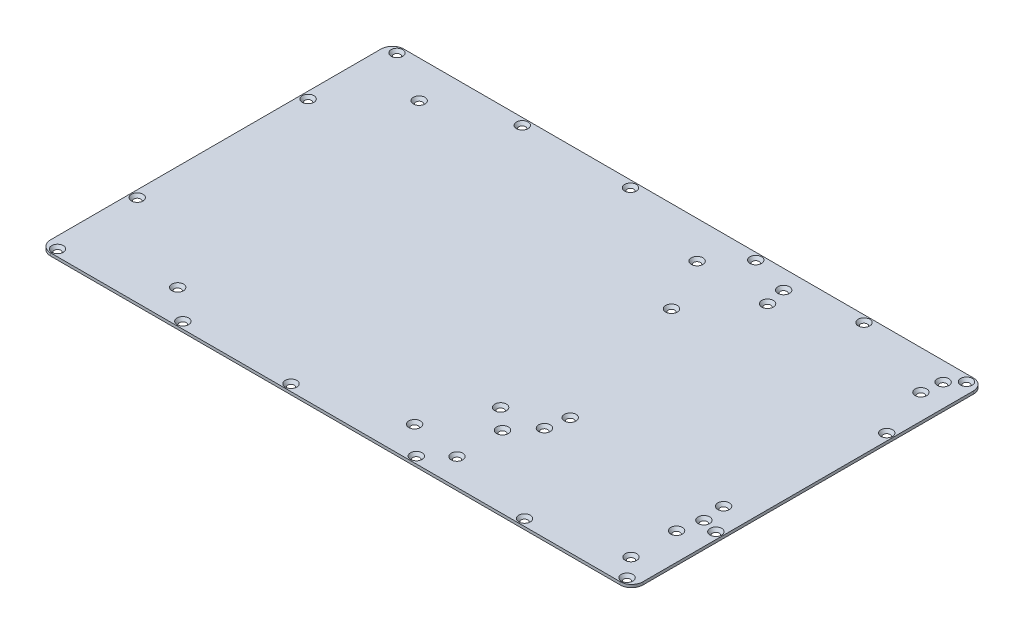
from build123d import *

# Parameters (mm, degrees)
SKETCH1_W                                     = 330.2
SKETCH1_H                                     = 196.85
BOSS_EXTRUDE1_DEPTH                           = 1.5875
FILLET1_R                                     = 6.35
CSK_FOR_4_FLAT_HEAD_SOCKET_CAP_SCREW1_A_COUNT = 2
CSK_FOR_4_FLAT_HEAD_SOCKET_CAP_SCREW1_A_PITCH = 95.25
LPATTERN1_COUNT                               = 2
LPATTERN1_PITCH                               = 120.015
CSK_FOR_4_FLAT_HEAD_SOCKET_CAP_SCREW2_A_COUNT = 2
CSK_FOR_4_FLAT_HEAD_SOCKET_CAP_SCREW2_A_PITCH = 57.15
CSK_FOR_4_FLAT_HEAD_SOCKET_CAP_SCRE_2_COUNT   = 2
CSK_FOR_4_FLAT_HEAD_SOCKET_CAP_SCRE_2_PITCH   = 117.475
CSK_FOR_4_FLAT_HEAD_SOCKET_CAP_SCRE_3_COUNT   = 2
CSK_FOR_4_FLAT_HEAD_SOCKET_CAP_SCRE_3_PITCH   = 187.325
CSK_FOR_4_FLAT_HEAD_SOCKET_CAP_SCRE_4_COUNT   = 2
CSK_FOR_4_FLAT_HEAD_SOCKET_CAP_SCRE_4_PITCH   = 247.65
CSK_FOR_4_FLAT_HEAD_SOCKET_CAP_SCRE_5_COUNT   = 2
CSK_FOR_4_FLAT_HEAD_SOCKET_CAP_SCRE_5_PITCH   = 317.5
CSK_FOR_4_FLAT_HEAD_SOCKET_CAP_SCREW3_A_COUNT = 2
CSK_FOR_4_FLAT_HEAD_SOCKET_CAP_SCREW3_A_PITCH = 88.9
CSK_FOR_4_FLAT_HEAD_SOCKET_CAP_SCRE_6_COUNT   = 2
CSK_FOR_4_FLAT_HEAD_SOCKET_CAP_SCRE_6_PITCH   = 160.266754194
CSK_FOR_4_FLAT_HEAD_SOCKET_CAP_SCRE_7_COUNT   = 2
CSK_FOR_4_FLAT_HEAD_SOCKET_CAP_SCRE_7_PITCH   = 133.35
CSK_FOR_4_FLAT_HEAD_SOCKET_CAP_SCREW4_A_COUNT = 2
CSK_FOR_4_FLAT_HEAD_SOCKET_CAP_SCREW4_A_PITCH = 85.4964
CSK_FOR_4_FLAT_HEAD_SOCKET_CAP_SCRE_8_COUNT   = 2
CSK_FOR_4_FLAT_HEAD_SOCKET_CAP_SCRE_8_PITCH   = 110.0074
CSK_FOR_4_FLAT_HEAD_SOCKET_CAP_SCRE_9_COUNT   = 2
CSK_FOR_4_FLAT_HEAD_SOCKET_CAP_SCRE_9_PITCH   = 139.324306809
CSK_FOR_4_FLAT_HEAD_SOCKET_CAP_SCREW5_A_COUNT = 2
CSK_FOR_4_FLAT_HEAD_SOCKET_CAP_SCREW5_A_PITCH = 25.4
CSK_FOR_4_FLAT_HEAD_SOCKET_CAP_SCRE_10_COUNT  = 2
CSK_FOR_4_FLAT_HEAD_SOCKET_CAP_SCRE_10_PITCH  = 97.028
CSK_FOR_4_FLAT_HEAD_SOCKET_CAP_SCRE_11_COUNT  = 2
CSK_FOR_4_FLAT_HEAD_SOCKET_CAP_SCRE_11_PITCH  = 100.297521325
CSK_FOR_4_FLAT_HEAD_SOCKET_CAP_SCREW6_A_COUNT = 2
CSK_FOR_4_FLAT_HEAD_SOCKET_CAP_SCREW6_A_PITCH = 154.94
CSK_FOR_4_FLAT_HEAD_SOCKET_CAP_SCRE_12_COUNT  = 2
CSK_FOR_4_FLAT_HEAD_SOCKET_CAP_SCRE_12_PITCH  = 220.921601479
CSK_FOR_4_FLAT_HEAD_SOCKET_CAP_SCRE_13_COUNT  = 2
CSK_FOR_4_FLAT_HEAD_SOCKET_CAP_SCRE_13_PITCH  = 159.130543894


with BuildPart() as part:
    # Sketch1 → Boss-Extrude1 (new body)
    with BuildSketch(Plane(origin=(0, 0, 0), x_dir=(1, 0, 0), z_dir=(0, 1, 0))):
        Rectangle(SKETCH1_W, SKETCH1_H)
    extrude(amount=BOSS_EXTRUDE1_DEPTH)

    # Fillet1
    fillet1_edges = [part.edges().sort_by_distance(p)[0] for p in [
        (-165.1, 0.79375, 98.425),
        (-165.1, 0.79375, -98.425),
        (165.1, 0.79375, -98.425),
        (165.1, 0.79375, 98.425),
    ]]
    fillet(fillet1_edges, radius=FILLET1_R)

    # Sketch2 → CSK for #4 Flat Head Socket Cap Screw1 (revolve, cut)
    with BuildSketch(Plane(origin=(161.29, 1.5875, 47.625), x_dir=(0, 0, 1), z_dir=(1, 0, 0))):
        Polygon((0, 0), (0, 1.5875), (1.63195, 1.5875), (1.63195, 1.848124365), (3.2385, 0), align=None)
    csk_for_4_flat_head_socket_cap_screw1 = revolve(axis=Axis((161.29, 7.9375, 47.625), (0, -1, 0)), mode=Mode.SUBTRACT)

    # CSK for #4 Flat Head Socket Cap Screw1 a: CSK for #4 Flat Head Socket Cap Screw1 ×2
    with Locations(*[(0, 0, -i * CSK_FOR_4_FLAT_HEAD_SOCKET_CAP_SCREW1_A_PITCH) for i in range(1, CSK_FOR_4_FLAT_HEAD_SOCKET_CAP_SCREW1_A_COUNT)]):
        add(csk_for_4_flat_head_socket_cap_screw1, mode=Mode.SUBTRACT)

    # LPattern1: CSK for #4 Flat Head Socket Cap Screw1 ×2
    with Locations(*[(-i * LPATTERN1_PITCH, 0, 0) for i in range(1, LPATTERN1_COUNT)]):
        add(csk_for_4_flat_head_socket_cap_screw1, mode=Mode.SUBTRACT)

    # LPattern1 copy 1 sketch → LPattern1 copy 1 (revolve, cut)
    with BuildSketch(Plane(origin=(41.275, 1.5875, -47.625), x_dir=(0, 0, 1), z_dir=(1, 0, 0))):
        Polygon((0, 0), (0, 1.5875), (1.63195, 1.5875), (1.63195, 1.848124365), (3.2385, 0), align=None)
    revolve(axis=Axis((41.275, 7.9375, -47.625), (0, -1, 0)), mode=Mode.SUBTRACT)

    # Mirror1: CSK for #4 Flat Head Socket Cap Screw1 across plane
    add(csk_for_4_flat_head_socket_cap_screw1.mirror(Plane(origin=(0, 0, 0), x_dir=(0, 0, 1), z_dir=(1, 0, 0))), mode=Mode.SUBTRACT)

    # Mirror1 copy 1 sketch → Mirror1 copy 1 (revolve, cut)
    with BuildSketch(Plane(origin=(-161.29, 1.5875, -47.625), x_dir=(0, 0, 1), z_dir=(-1, 0, 0))):
        Polygon((0, 0), (0, -1.5875), (1.63195, -1.5875), (1.63195, -1.848124365), (3.2385, 0), align=None)
    revolve(axis=Axis((-161.29, 7.9375, -47.625), (0, 1, 0)), mode=Mode.SUBTRACT)

    # Sketch7 → CSK for #4 Flat Head Socket Cap Screw2 (revolve, cut)
    with BuildSketch(Plane(origin=(158.75, 1.5875, 94.615), x_dir=(0, 0, 1), z_dir=(1, 0, 0))):
        Polygon((0, 0), (0, 1.5875), (1.63195, 1.5875), (1.63195, 1.848124365), (3.2385, 0), align=None)
    csk_for_4_flat_head_socket_cap_screw2 = revolve(axis=Axis((158.75, 7.9375, 94.615), (0, -1, 0)), mode=Mode.SUBTRACT)

    # CSK for #4 Flat Head Socket Cap Screw2 a: CSK for #4 Flat Head Socket Cap Screw2 ×2
    with Locations(*[(-i * CSK_FOR_4_FLAT_HEAD_SOCKET_CAP_SCREW2_A_PITCH, 0, 0) for i in range(1, CSK_FOR_4_FLAT_HEAD_SOCKET_CAP_SCREW2_A_COUNT)]):
        add(csk_for_4_flat_head_socket_cap_screw2, mode=Mode.SUBTRACT)

    # CSK for _4 Flat Head Socket Cap Scre 2: CSK for #4 Flat Head Socket Cap Screw2 ×2
    with Locations(*[(-i * CSK_FOR_4_FLAT_HEAD_SOCKET_CAP_SCRE_2_PITCH, 0, 0) for i in range(1, CSK_FOR_4_FLAT_HEAD_SOCKET_CAP_SCRE_2_COUNT)]):
        add(csk_for_4_flat_head_socket_cap_screw2, mode=Mode.SUBTRACT)

    # CSK for _4 Flat Head Socket Cap Scre 3: CSK for #4 Flat Head Socket Cap Screw2 ×2
    with Locations(*[(-i * CSK_FOR_4_FLAT_HEAD_SOCKET_CAP_SCRE_3_PITCH, 0, 0) for i in range(1, CSK_FOR_4_FLAT_HEAD_SOCKET_CAP_SCRE_3_COUNT)]):
        add(csk_for_4_flat_head_socket_cap_screw2, mode=Mode.SUBTRACT)

    # CSK for _4 Flat Head Socket Cap Scre 4: CSK for #4 Flat Head Socket Cap Screw2 ×2
    with Locations(*[(-i * CSK_FOR_4_FLAT_HEAD_SOCKET_CAP_SCRE_4_PITCH, 0, 0) for i in range(1, CSK_FOR_4_FLAT_HEAD_SOCKET_CAP_SCRE_4_COUNT)]):
        add(csk_for_4_flat_head_socket_cap_screw2, mode=Mode.SUBTRACT)

    # CSK for _4 Flat Head Socket Cap Scre 5: CSK for #4 Flat Head Socket Cap Screw2 ×2
    with Locations(*[(-i * CSK_FOR_4_FLAT_HEAD_SOCKET_CAP_SCRE_5_PITCH, 0, 0) for i in range(1, CSK_FOR_4_FLAT_HEAD_SOCKET_CAP_SCRE_5_COUNT)]):
        add(csk_for_4_flat_head_socket_cap_screw2, mode=Mode.SUBTRACT)

    # Mirror2: CSK for #4 Flat Head Socket Cap Screw2 across plane
    add(csk_for_4_flat_head_socket_cap_screw2.mirror(Plane.XY), mode=Mode.SUBTRACT)

    # Mirror2 copy 1 sketch → Mirror2 copy 1 (revolve, cut)
    with BuildSketch(Plane(origin=(101.6, 1.5875, -94.615), x_dir=(0, 0, -1), z_dir=(1, 0, 0))):
        Polygon((0, 0), (0, -1.5875), (1.63195, -1.5875), (1.63195, -1.848124365), (3.2385, 0), align=None)
    revolve(axis=Axis((101.6, 7.9375, -94.615), (0, 1, 0)), mode=Mode.SUBTRACT)

    # Mirror2 copy 2 sketch → Mirror2 copy 2 (revolve, cut)
    with BuildSketch(Plane(origin=(41.275, 1.5875, -94.615), x_dir=(0, 0, -1), z_dir=(1, 0, 0))):
        Polygon((0, 0), (0, -1.5875), (1.63195, -1.5875), (1.63195, -1.848124365), (3.2385, 0), align=None)
    revolve(axis=Axis((41.275, 7.9375, -94.615), (0, 1, 0)), mode=Mode.SUBTRACT)

    # Mirror2 copy 3 sketch → Mirror2 copy 3 (revolve, cut)
    with BuildSketch(Plane(origin=(-28.575, 1.5875, -94.615), x_dir=(0, 0, -1), z_dir=(1, 0, 0))):
        Polygon((0, 0), (0, -1.5875), (1.63195, -1.5875), (1.63195, -1.848124365), (3.2385, 0), align=None)
    revolve(axis=Axis((-28.575, 7.9375, -94.615), (0, 1, 0)), mode=Mode.SUBTRACT)

    # Mirror2 copy 4 sketch → Mirror2 copy 4 (revolve, cut)
    with BuildSketch(Plane(origin=(-88.9, 1.5875, -94.615), x_dir=(0, 0, -1), z_dir=(1, 0, 0))):
        Polygon((0, 0), (0, -1.5875), (1.63195, -1.5875), (1.63195, -1.848124365), (3.2385, 0), align=None)
    revolve(axis=Axis((-88.9, 7.9375, -94.615), (0, 1, 0)), mode=Mode.SUBTRACT)

    # Mirror2 copy 5 sketch → Mirror2 copy 5 (revolve, cut)
    with BuildSketch(Plane(origin=(-158.75, 1.5875, -94.615), x_dir=(0, 0, -1), z_dir=(1, 0, 0))):
        Polygon((0, 0), (0, -1.5875), (1.63195, -1.5875), (1.63195, -1.848124365), (3.2385, 0), align=None)
    revolve(axis=Axis((-158.75, 7.9375, -94.615), (0, 1, 0)), mode=Mode.SUBTRACT)

    # Sketch9 → CSK for #4 Flat Head Socket Cap Screw3 (revolve, cut)
    with BuildSketch(Plane(origin=(152.4, 1.5875, -87.9348), x_dir=(0, 0, 1), z_dir=(1, 0, 0))):
        Polygon((0, 0), (0, 1.5875), (1.63195, 1.5875), (1.63195, 1.848124365), (3.2385, 0), align=None)
    csk_for_4_flat_head_socket_cap_screw3 = revolve(axis=Axis((152.4, 7.9375, -87.9348), (0, -1, 0)), mode=Mode.SUBTRACT)

    # CSK for #4 Flat Head Socket Cap Screw3 a: CSK for #4 Flat Head Socket Cap Screw3 ×2
    with Locations(*[(-i * CSK_FOR_4_FLAT_HEAD_SOCKET_CAP_SCREW3_A_PITCH, 0, 0) for i in range(1, CSK_FOR_4_FLAT_HEAD_SOCKET_CAP_SCREW3_A_COUNT)]):
        add(csk_for_4_flat_head_socket_cap_screw3, mode=Mode.SUBTRACT)

    # CSK for _4 Flat Head Socket Cap Scre 6: CSK for #4 Flat Head Socket Cap Screw3 ×2
    with Locations(*[Vector(-0.5547001962252291, 0, 0.8320502943378437) * (i * CSK_FOR_4_FLAT_HEAD_SOCKET_CAP_SCRE_6_PITCH) for i in range(1, CSK_FOR_4_FLAT_HEAD_SOCKET_CAP_SCRE_6_COUNT)]):
        add(csk_for_4_flat_head_socket_cap_screw3, mode=Mode.SUBTRACT)

    # CSK for _4 Flat Head Socket Cap Scre 7: CSK for #4 Flat Head Socket Cap Screw3 ×2
    with Locations(*[(0, 0, i * CSK_FOR_4_FLAT_HEAD_SOCKET_CAP_SCRE_7_PITCH) for i in range(1, CSK_FOR_4_FLAT_HEAD_SOCKET_CAP_SCRE_7_COUNT)]):
        add(csk_for_4_flat_head_socket_cap_screw3, mode=Mode.SUBTRACT)

    # Sketch11 → CSK for #4 Flat Head Socket Cap Screw4 (revolve, cut)
    with BuildSketch(Plane(origin=(65.6336, 1.5875, -76.835), x_dir=(0, 0, 1), z_dir=(1, 0, 0))):
        Polygon((0, 0), (0, 1.5875), (1.63195, 1.5875), (1.63195, 1.848124365), (3.2385, 0), align=None)
    csk_for_4_flat_head_socket_cap_screw4 = revolve(axis=Axis((65.6336, 7.9375, -76.835), (0, -1, 0)), mode=Mode.SUBTRACT)

    # CSK for #4 Flat Head Socket Cap Screw4 a: CSK for #4 Flat Head Socket Cap Screw4 ×2
    with Locations(*[(i * CSK_FOR_4_FLAT_HEAD_SOCKET_CAP_SCREW4_A_PITCH, 0, 0) for i in range(1, CSK_FOR_4_FLAT_HEAD_SOCKET_CAP_SCREW4_A_COUNT)]):
        add(csk_for_4_flat_head_socket_cap_screw4, mode=Mode.SUBTRACT)

    # CSK for _4 Flat Head Socket Cap Scre 8: CSK for #4 Flat Head Socket Cap Screw4 ×2
    with Locations(*[(0, 0, i * CSK_FOR_4_FLAT_HEAD_SOCKET_CAP_SCRE_8_PITCH) for i in range(1, CSK_FOR_4_FLAT_HEAD_SOCKET_CAP_SCRE_8_COUNT)]):
        add(csk_for_4_flat_head_socket_cap_screw4, mode=Mode.SUBTRACT)

    # CSK for _4 Flat Head Socket Cap Scre 9: CSK for #4 Flat Head Socket Cap Screw4 ×2
    with Locations(*[Vector(0.6136502808329188, 0, 0.7895779460152619) * (i * CSK_FOR_4_FLAT_HEAD_SOCKET_CAP_SCRE_9_PITCH) for i in range(1, CSK_FOR_4_FLAT_HEAD_SOCKET_CAP_SCRE_9_COUNT)]):
        add(csk_for_4_flat_head_socket_cap_screw4, mode=Mode.SUBTRACT)

    # Sketch13 → CSK for #4 Flat Head Socket Cap Screw5 (revolve, cut)
    with BuildSketch(Plane(origin=(149.86, 1.5875, 58.1152), x_dir=(0, 0, 1), z_dir=(1, 0, 0))):
        Polygon((0, 0), (0, 1.5875), (1.63195, 1.5875), (1.63195, 1.848124365), (3.2385, 0), align=None)
    csk_for_4_flat_head_socket_cap_screw5 = revolve(axis=Axis((149.86, 7.9375, 58.1152), (0, -1, 0)), mode=Mode.SUBTRACT)

    # CSK for #4 Flat Head Socket Cap Screw5 a: CSK for #4 Flat Head Socket Cap Screw5 ×2
    with Locations(*[(0, 0, i * CSK_FOR_4_FLAT_HEAD_SOCKET_CAP_SCREW5_A_PITCH) for i in range(1, CSK_FOR_4_FLAT_HEAD_SOCKET_CAP_SCREW5_A_COUNT)]):
        add(csk_for_4_flat_head_socket_cap_screw5, mode=Mode.SUBTRACT)

    # CSK for _4 Flat Head Socket Cap Scre 10: CSK for #4 Flat Head Socket Cap Screw5 ×2
    with Locations(*[(-i * CSK_FOR_4_FLAT_HEAD_SOCKET_CAP_SCRE_10_PITCH, 0, 0) for i in range(1, CSK_FOR_4_FLAT_HEAD_SOCKET_CAP_SCRE_10_COUNT)]):
        add(csk_for_4_flat_head_socket_cap_screw5, mode=Mode.SUBTRACT)

    # CSK for _4 Flat Head Socket Cap Scre 11: CSK for #4 Flat Head Socket Cap Screw5 ×2
    with Locations(*[Vector(-0.9674017734226894, 0, 0.25324653754520676) * (i * CSK_FOR_4_FLAT_HEAD_SOCKET_CAP_SCRE_11_PITCH) for i in range(1, CSK_FOR_4_FLAT_HEAD_SOCKET_CAP_SCRE_11_COUNT)]):
        add(csk_for_4_flat_head_socket_cap_screw5, mode=Mode.SUBTRACT)

    # Sketch15 → CSK for #4 Flat Head Socket Cap Screw6 (revolve, cut)
    with BuildSketch(Plane(origin=(-129.54, 1.5875, -77.7748), x_dir=(0, 0, 1), z_dir=(1, 0, 0))):
        Polygon((0, 0), (0, 1.5875), (1.63195, 1.5875), (1.63195, 1.848124365), (3.2385, 0), align=None)
    csk_for_4_flat_head_socket_cap_screw6 = revolve(axis=Axis((-129.54, 7.9375, -77.7748), (0, -1, 0)), mode=Mode.SUBTRACT)

    # CSK for #4 Flat Head Socket Cap Screw6 a: CSK for #4 Flat Head Socket Cap Screw6 ×2
    with Locations(*[(i * CSK_FOR_4_FLAT_HEAD_SOCKET_CAP_SCREW6_A_PITCH, 0, 0) for i in range(1, CSK_FOR_4_FLAT_HEAD_SOCKET_CAP_SCREW6_A_COUNT)]):
        add(csk_for_4_flat_head_socket_cap_screw6, mode=Mode.SUBTRACT)

    # CSK for _4 Flat Head Socket Cap Scre 12: CSK for #4 Flat Head Socket Cap Screw6 ×2
    with Locations(*[Vector(0.7013347674595831, 0, 0.7128320587294124) * (i * CSK_FOR_4_FLAT_HEAD_SOCKET_CAP_SCRE_12_PITCH) for i in range(1, CSK_FOR_4_FLAT_HEAD_SOCKET_CAP_SCRE_12_COUNT)]):
        add(csk_for_4_flat_head_socket_cap_screw6, mode=Mode.SUBTRACT)

    # CSK for _4 Flat Head Socket Cap Scre 13: CSK for #4 Flat Head Socket Cap Screw6 ×2
    with Locations(*[Vector(0.14365563920417196, 0, 0.9896277367398515) * (i * CSK_FOR_4_FLAT_HEAD_SOCKET_CAP_SCRE_13_PITCH) for i in range(1, CSK_FOR_4_FLAT_HEAD_SOCKET_CAP_SCRE_13_COUNT)]):
        add(csk_for_4_flat_head_socket_cap_screw6, mode=Mode.SUBTRACT)


solid = part.part
